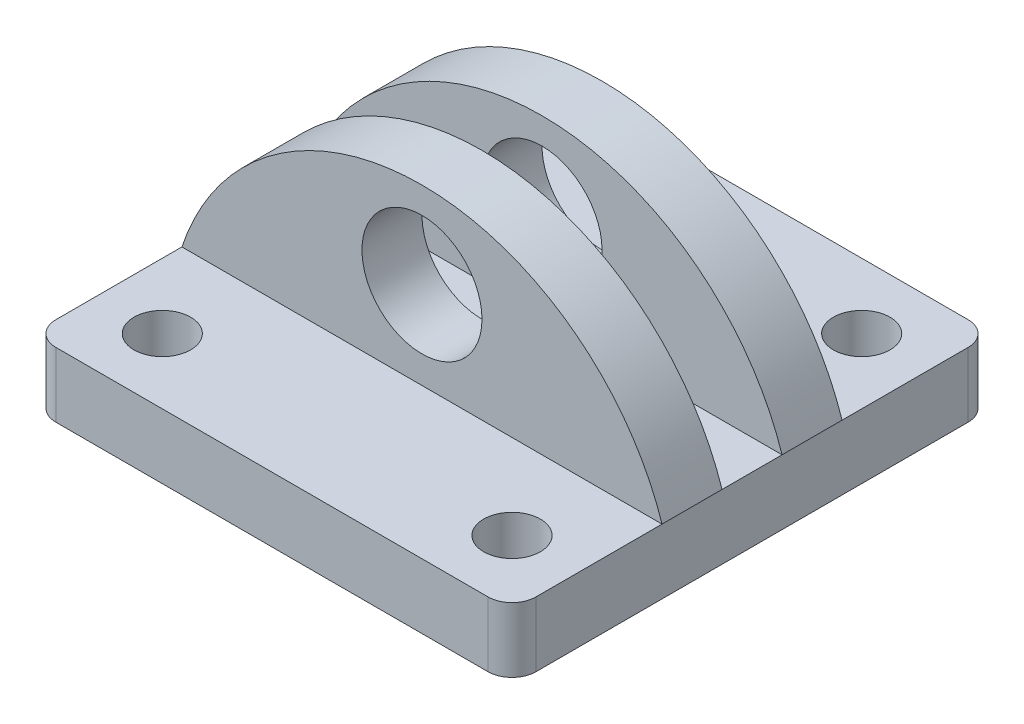
from build123d import *

# Parameters (mm, degrees)
SKETCH1_R           = 2.999994
BOSS_EXTRUDE1_DEPTH = 6.858
SKETCH2_W           = 50.8
SKETCH2_H           = 19.05
BOSS_EXTRUDE2_DEPTH = 24.892
SKETCH3_R           = 6.35
CUT_EXTRUDE1_DEPTH  = 24.892
SKETCH4_W           = 6.35
SKETCH4_H           = 18.373928642
CUT_EXTRUDE2_DEPTH  = 58.166


with BuildPart() as part:
    # Sketch1 → Boss-Extrude1 (new body)
    with BuildSketch(Plane(origin=(0, 0, 0), x_dir=(1, 0, 0), z_dir=(0, 1, 0))):
        with BuildLine():
            Line((22.86, -25.4), (-22.86, -25.4))
            ThreePointArc((-22.86, -25.4), (-24.656051224, -24.656051224), (-25.4, -22.86))
            Line((-25.4, -22.86), (-25.4, 22.86))
            ThreePointArc((-25.4, 22.86), (-24.656051224, 24.656051224), (-22.86, 25.4))
            Line((-22.86, 25.4), (22.86, 25.4))
            ThreePointArc((22.86, 25.4), (24.656051224, 24.656051224), (25.4, 22.86))
            Line((25.4, 22.86), (25.4, -22.86))
            ThreePointArc((25.4, -22.86), (24.656051224, -24.656051224), (22.86, -25.4))
        make_face()
        with Locations((-18.499963, 18.499963)):
            Circle(SKETCH1_R, mode=Mode.SUBTRACT)
        with Locations((18.499963, 18.499963)):
            Circle(SKETCH1_R, mode=Mode.SUBTRACT)
        with Locations((18.499963, -18.499963)):
            Circle(SKETCH1_R, mode=Mode.SUBTRACT)
        with Locations((-18.499963, -18.499963)):
            Circle(SKETCH1_R, mode=Mode.SUBTRACT)
    extrude(amount=BOSS_EXTRUDE1_DEPTH)

    # Sketch2 → Boss-Extrude2 (add)
    with BuildSketch(Plane(origin=(0, 6.858, 0), x_dir=(1, 0, 0), z_dir=(0, 1, 0))):
        Rectangle(SKETCH2_W, SKETCH2_H)
    extrude(amount=BOSS_EXTRUDE2_DEPTH)

    # Sketch3 → Cut-Extrude1 (cut)
    with BuildSketch(Plane.XY.offset(9.525)):
        with BuildLine():
            Line((25.4, 31.75), (-25.4, 31.75))
            Line((-25.4, 31.75), (-25.4, 6.858))
            ThreePointArc((-25.4, 6.858), (0, 25.231928642), (25.4, 6.858))
            Line((25.4, 6.858), (25.4, 31.75))
        make_face()
        with Locations((0, 16.103217479)):
            Circle(SKETCH3_R)
    extrude(amount=-CUT_EXTRUDE1_DEPTH, mode=Mode.SUBTRACT)

    # Sketch4 → Cut-Extrude2 (cut)
    with BuildSketch(Plane.ZY.offset(25.4)):
        with Locations((0, 16.044964321)):
            Rectangle(SKETCH4_W, SKETCH4_H)
    extrude(amount=-CUT_EXTRUDE2_DEPTH, mode=Mode.SUBTRACT)


solid = part.part
